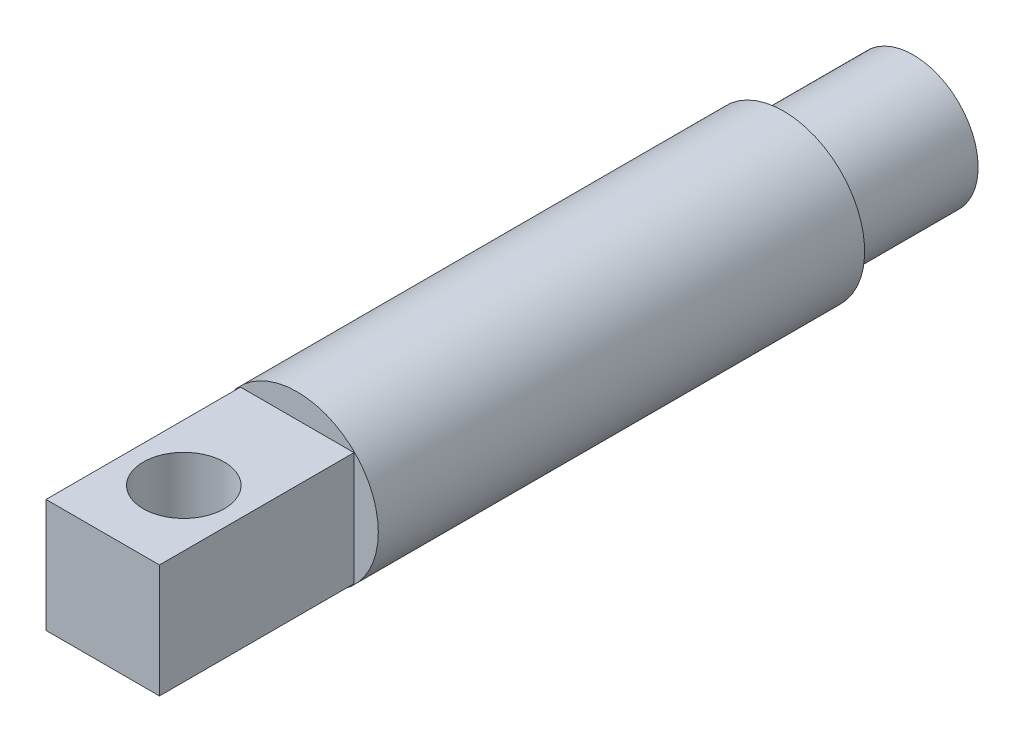
from build123d import *

# Parameters (mm, degrees)
ESQUISSE1_R                 = 5
BOSS_EXTRU_1_DEPTH          = 70
ESQUISSE2_R                 = 30
BOSS_EXTRU_2_DEPTH          = 5
ESQUISSE3_R                 = 3.5
BOSS_EXTRU_3_DEPTH          = 12
BOSS_EXTRU_4_START          = 12
ESQUISSE4_R                 = 3.5
BOSS_EXTRU_4_DEPTH          = 12
ENL_V_MAT_EXTRU_1_DEPTH     = 10
ESQUISSE6_R                 = 30
ENL_V_MAT_EXTRU_2_DEPTH     = 47
ESQUISSE7_R                 = 5
BOSS_EXTRU_5_DEPTH          = 3
ESQUISSE8_R                 = 4
BOSS_EXTRU_6_DEPTH          = 12
ENL_V_START                 = -12
ENL_V_MAT_EXTRU_3_OUTLINE_R = 5
ENL_V_MAT_EXTRU_3_OUTLINE_W = 7
ENL_V_MAT_EXTRU_3_OUTLINE_H = 7
ENL_V_MAT_EXTRU_3_DEPTH     = 12
ESQUISSE10_R                = 2.5
ENL_V_MAT_EXTRU_4_DEPTH     = 40.258756985
BOSS_EXTRU_7_START          = 4
ESQUISSE11_R                = 5
ESQUISSE11_R_2              = 4
BOSS_EXTRU_7_DEPTH          = 4


# Read off the part's stored shape, not the designer's step: Enlèv. mat.-Extru.3
with BuildPart() as part:
    # Esquisse1 → Boss.-Extru.1 (new body)
    with BuildSketch(Plane.XY):
        Circle(ESQUISSE1_R)
    extrude(amount=BOSS_EXTRU_1_DEPTH)

    # Esquisse2 → Boss.-Extru.2 (add)
    with BuildSketch(Plane.XY.offset(70)):
        Circle(ESQUISSE2_R)
    extrude(amount=-BOSS_EXTRU_2_DEPTH)

    # Esquisse3 → Boss.-Extru.3 (add)
    with BuildSketch(Plane(origin=(0, 0, 0), x_dir=(-1, 0, 0), z_dir=(0, 0, -1))):
        Circle(ESQUISSE3_R)
    extrude(amount=BOSS_EXTRU_3_DEPTH)

    # Esquisse4 → Boss.-Extru.4 (add)
    with BuildSketch(Plane.XY.offset(70).offset(BOSS_EXTRU_4_START)):
        with Locations(Location((0, 0, 0), (0, 0, 180))):
            Circle(ESQUISSE4_R)
    extrude(amount=-BOSS_EXTRU_4_DEPTH)

    # Esquisse5 → Enlèv. mat.-Extru.1 (cut)
    with BuildSketch(Plane.XY.offset(70)):
        with BuildLine():
            ThreePointArc((3.911624902, 29.743893333), (1.96, 29.935904864), (0, 30))
            Line((0, 30), (1.54, 24.952522919))
            ThreePointArc((1.54, 24.952522919), (1.639797772, 24.946163298), (1.739569306, 24.939404536))
            Line((1.739569306, 24.939404536), (3.911624902, 29.743893333))
        make_face()
        with BuildLine():
            Line((-1.54, 24.952522919), (0, 30))
            ThreePointArc((0, 30), (-1.96, 29.935904864), (-3.911624902, 29.743893333))
            Line((-3.911624902, 29.743893333), (-1.739569306, 24.939404536))
            ThreePointArc((-1.739569306, 24.939404536), (-1.639797772, 24.946163298), (-1.54, 24.952522919))
        make_face()
        with BuildLine():
            ThreePointArc((7.75646359, 28.979946042), (5.846535396, 29.424785876), (3.911624902, 29.743893333))
            Line((3.911624902, 29.743893333), (4.793067146, 24.536228466))
            ThreePointArc((4.793067146, 24.536228466), (4.878466786, 24.519391547), (4.963807286, 24.50225739))
            Line((4.963807286, 24.50225739), (7.75646359, 28.979946042))
        make_face()
        with BuildLine():
            Line((-4.793067146, 24.536228466), (-3.911624902, 29.743893333))
            ThreePointArc((-3.911624902, 29.743893333), (-5.846535396, 29.424785876), (-7.75646359, 28.979946042))
            Line((-7.75646359, 28.979946042), (-4.963807286, 24.50225739))
            ThreePointArc((-4.963807286, 24.50225739), (-4.878466786, 24.519391547), (-4.793067146, 24.536228466))
        make_face()
        with BuildLine():
            ThreePointArc((11.468870142, 27.721201591), (9.633248345, 28.411274634), (7.75646359, 28.979946042))
            Line((7.75646359, 28.979946042), (7.939081747, 23.705927128))
            ThreePointArc((7.939081747, 23.705927128), (8.021571427, 23.678141647), (8.103963866, 23.650069126))
            Line((8.103963866, 23.650069126), (11.468870142, 27.721201591))
        make_face()
        with BuildLine():
            Line((-7.939081747, 23.705927128), (-7.75646359, 28.979946042))
            ThreePointArc((-7.75646359, 28.979946042), (-9.633248345, 28.411274634), (-11.468870142, 27.721201591))
            Line((-11.468870142, 27.721201591), (-8.103963866, 23.650069126))
            ThreePointArc((-8.103963866, 23.650069126), (-8.021571427, 23.678141647), (-7.939081747, 23.705927128))
        make_face()
        with BuildLine():
            ThreePointArc((14.985459754, 25.989151505), (13.255485353, 26.912675602), (11.468870142, 27.721201591))
            Line((11.468870142, 27.721201591), (10.950617091, 22.474073626))
            ThreePointArc((10.950617091, 22.474073626), (11.04042578, 22.430091364), (11.130057821, 22.38575022))
            Line((11.130057821, 22.38575022), (14.985459754, 25.989151505))
        make_face()
        with BuildLine():
            Line((-10.950617091, 22.474073626), (-11.468870142, 27.721201591))
            ThreePointArc((-11.468870142, 27.721201591), (-13.255485353, 26.912675602), (-14.985459754, 25.989151505))
            Line((-14.985459754, 25.989151505), (-11.130057821, 22.38575022))
            ThreePointArc((-11.130057821, 22.38575022), (-11.04042578, 22.430091364), (-10.950617091, 22.474073626))
        make_face()
        with BuildLine():
            ThreePointArc((18.246190956, 23.813368422), (16.65140115, 24.954575527), (14.985459754, 25.989151505))
            Line((14.985459754, 25.989151505), (13.798277376, 20.847243018))
            ThreePointArc((13.798277376, 20.847243018), (13.870778356, 20.799074686), (13.943111187, 20.750654217))
            Line((13.943111187, 20.750654217), (18.246190956, 23.813368422))
        make_face()
        with BuildLine():
            Line((-13.798277376, 20.847243018), (-14.985459754, 25.989151505))
            ThreePointArc((-14.985459754, 25.989151505), (-16.65140115, 24.954575527), (-18.246190956, 23.813368422))
            Line((-18.246190956, 23.813368422), (-13.943111187, 20.750654217))
            ThreePointArc((-13.943111187, 20.750654217), (-13.870778356, 20.799074686), (-13.798277376, 20.847243018))
        make_face()
        with BuildLine():
            ThreePointArc((21.195390749, 21.231001177), (19.763014623, 22.570406576), (18.246190956, 23.813368422))
            Line((18.246190956, 23.813368422), (16.388920873, 18.878645942))
            ThreePointArc((16.388920873, 18.878645942), (16.464304345, 18.812939229), (16.539424387, 18.746931507))
            Line((16.539424387, 18.746931507), (21.195390749, 21.231001177))
        make_face()
        with BuildLine():
            Line((-16.388920873, 18.878645942), (-18.246190956, 23.813368422))
            ThreePointArc((-18.246190956, 23.813368422), (-19.763014623, 22.570406576), (-21.195390749, 21.231001177))
            Line((-21.195390749, 21.231001177), (-16.539424387, 18.746931507))
            ThreePointArc((-16.539424387, 18.746931507), (-16.464304345, 18.812939229), (-16.388920873, 18.878645942))
        make_face()
        with BuildLine():
            ThreePointArc((23.78270515, 18.286140537), (22.537198777, 19.800875518), (21.195390749, 21.231001177))
            Line((21.195390749, 21.231001177), (18.719140508, 16.57087139))
            ThreePointArc((18.719140508, 16.57087139), (18.78527424, 16.495862261), (18.851107406, 16.420589196))
            Line((18.851107406, 16.420589196), (23.78270515, 18.286140537))
        make_face()
        with BuildLine():
            Line((-18.719140508, 16.57087139), (-21.195390749, 21.231001177))
            ThreePointArc((-21.195390749, 21.231001177), (-22.537198777, 19.800875518), (-23.78270515, 18.286140537))
            Line((-23.78270515, 18.286140537), (-18.851107406, 16.420589196))
            ThreePointArc((-18.851107406, 16.420589196), (-18.78527424, 16.495862261), (-18.719140508, 16.57087139))
        make_face()
        with BuildLine():
            ThreePointArc((25.963958928, 15.029066397), (24.926587807, 16.693268712), (23.78270515, 18.286140537))
            Line((23.78270515, 18.286140537), (20.727218802, 13.97792548))
            ThreePointArc((20.727218802, 13.97792548), (20.775760628, 13.905674034), (20.824050599, 13.833254016))
            Line((20.824050599, 13.833254016), (25.963958928, 15.029066397))
        make_face()
        with BuildLine():
            Line((-20.727218802, 13.97792548), (-23.78270515, 18.286140537))
            ThreePointArc((-23.78270515, 18.286140537), (-24.926587807, 16.693268712), (-25.963958928, 15.029066397))
            Line((-25.963958928, 15.029066397), (-20.824050599, 13.833254016))
            ThreePointArc((-20.824050599, 13.833254016), (-20.775760628, 13.905674034), (-20.727218802, 13.97792548))
        make_face()
        with BuildLine():
            ThreePointArc((27.701909842, 11.515389317), (26.890385817, 13.300644745), (25.963958928, 15.029066397))
            Line((25.963958928, 15.029066397), (22.367034749, 11.167620899))
            ThreePointArc((22.367034749, 11.167620899), (22.405781894, 11.089677079), (22.444257425, 11.011598824))
            Line((22.444257425, 11.011598824), (27.701909842, 11.515389317))
        make_face()
        with BuildLine():
            Line((-22.367034749, 11.167620899), (-25.963958928, 15.029066397))
            ThreePointArc((-25.963958928, 15.029066397), (-26.890385817, 13.300644745), (-27.701909842, 11.515389317))
            Line((-27.701909842, 11.515389317), (-22.444257425, 11.011598824))
            ThreePointArc((-22.444257425, 11.011598824), (-22.405781894, 11.089677079), (-22.367034749, 11.167620899))
        make_face()
        with BuildLine():
            ThreePointArc((28.966884502, 7.805101039), (28.395063354, 9.680928526), (27.701909842, 11.515389317))
            Line((27.701909842, 11.515389317), (23.627977885, 8.168149181))
            ThreePointArc((23.627977885, 8.168149181), (23.660461458, 8.073571924), (23.692566461, 7.97886549))
            Line((23.692566461, 7.97886549), (28.966884502, 7.805101039))
        make_face()
        with BuildLine():
            Line((-23.627977885, 8.168149181), (-27.701909842, 11.515389317))
            ThreePointArc((-27.701909842, 11.515389317), (-28.395063354, 9.680928526), (-28.966884502, 7.805101039))
            Line((-28.966884502, 7.805101039), (-23.692566461, 7.97886549))
            ThreePointArc((-23.692566461, 7.97886549), (-23.660461458, 8.073571924), (-23.627977885, 8.168149181))
        make_face()
        with BuildLine():
            ThreePointArc((29.737285014, 3.9615502), (29.41492989, 5.895922284), (28.966884502, 7.805101039))
            Line((28.966884502, 7.805101039), (24.493890167, 5.004932014))
            ThreePointArc((24.493890167, 5.004932014), (24.513713944, 4.906916414), (24.533145499, 4.808822302))
            Line((24.533145499, 4.808822302), (29.737285014, 3.9615502))
        make_face()
        with BuildLine():
            Line((-24.493890167, 5.004932014), (-28.966884502, 7.805101039))
            ThreePointArc((-28.966884502, 7.805101039), (-29.41492989, 5.895922284), (-29.737285014, 3.9615502))
            Line((-29.737285014, 3.9615502), (-24.533145499, 4.808822302))
            ThreePointArc((-24.533145499, 4.808822302), (-24.513713944, 4.906916414), (-24.493890167, 5.004932014))
        make_face()
        with BuildLine():
            ThreePointArc((29.99995773, 0.050360733), (29.932572449, 2.010250376), (29.737285014, 3.9615502))
            Line((29.737285014, 3.9615502), (24.938282315, 1.755583995))
            ThreePointArc((24.938282315, 1.755583995), (24.944243639, 1.668744817), (24.949902576, 1.581885408))
            Line((24.949902576, 1.581885408), (29.99995773, 0.050360733))
        make_face()
        with BuildLine():
            Line((-24.938282315, 1.755583995), (-29.737285014, 3.9615502))
            ThreePointArc((-29.737285014, 3.9615502), (-29.932572449, 2.010250376), (-29.99995773, 0.050360733))
            Line((-29.99995773, 0.050360733), (-24.949902576, 1.581885408))
            ThreePointArc((-24.949902576, 1.581885408), (-24.944243639, 1.668744817), (-24.938282315, 1.755583995))
        make_face()
        with BuildLine():
            Line((-24.949902576, -1.581885408), (-29.99995773, -0.050360733))
            ThreePointArc((-29.99995773, -0.050360733), (-29.932572449, -2.010250376), (-29.737285014, -3.9615502))
            Line((-29.737285014, -3.9615502), (-24.938282315, -1.755583995))
            ThreePointArc((-24.938282315, -1.755583995), (-24.944243639, -1.668744817), (-24.949902576, -1.581885408))
        make_face()
        with BuildLine():
            ThreePointArc((29.737285014, -3.9615502), (29.932572449, -2.010250376), (29.99995773, -0.050360733))
            Line((29.99995773, -0.050360733), (24.949902576, -1.581885408))
            ThreePointArc((24.949902576, -1.581885408), (24.944243639, -1.668744817), (24.938282315, -1.755583995))
            Line((24.938282315, -1.755583995), (29.737285014, -3.9615502))
        make_face()
        with BuildLine():
            Line((-24.533145499, -4.808822302), (-29.737285014, -3.9615502))
            ThreePointArc((-29.737285014, -3.9615502), (-29.41492989, -5.895922284), (-28.966884502, -7.805101039))
            Line((-28.966884502, -7.805101039), (-24.493890167, -5.004932014))
            ThreePointArc((-24.493890167, -5.004932014), (-24.513713944, -4.906916414), (-24.533145499, -4.808822302))
        make_face()
        with BuildLine():
            ThreePointArc((28.966884502, -7.805101039), (29.41492989, -5.895922284), (29.737285014, -3.9615502))
            Line((29.737285014, -3.9615502), (24.533145499, -4.808822302))
            ThreePointArc((24.533145499, -4.808822302), (24.513713944, -4.906916414), (24.493890167, -5.004932014))
            Line((24.493890167, -5.004932014), (28.966884502, -7.805101039))
        make_face()
        with BuildLine():
            Line((-23.692566461, -7.97886549), (-28.966884502, -7.805101039))
            ThreePointArc((-28.966884502, -7.805101039), (-28.395063354, -9.680928526), (-27.701909842, -11.515389317))
            Line((-27.701909842, -11.515389317), (-23.627977885, -8.168149181))
            ThreePointArc((-23.627977885, -8.168149181), (-23.660461458, -8.073571924), (-23.692566461, -7.97886549))
        make_face()
        with BuildLine():
            ThreePointArc((27.701909842, -11.515389317), (28.395063354, -9.680928526), (28.966884502, -7.805101039))
            Line((28.966884502, -7.805101039), (23.692566461, -7.97886549))
            ThreePointArc((23.692566461, -7.97886549), (23.660461458, -8.073571924), (23.627977885, -8.168149181))
            Line((23.627977885, -8.168149181), (27.701909842, -11.515389317))
        make_face()
        with BuildLine():
            Line((-22.444257425, -11.011598824), (-27.701909842, -11.515389317))
            ThreePointArc((-27.701909842, -11.515389317), (-26.890385817, -13.300644745), (-25.963958928, -15.029066397))
            Line((-25.963958928, -15.029066397), (-22.367034749, -11.167620899))
            ThreePointArc((-22.367034749, -11.167620899), (-22.405781894, -11.089677079), (-22.444257425, -11.011598824))
        make_face()
        with BuildLine():
            ThreePointArc((25.963958928, -15.029066397), (26.890385817, -13.300644745), (27.701909842, -11.515389317))
            Line((27.701909842, -11.515389317), (22.444257425, -11.011598824))
            ThreePointArc((22.444257425, -11.011598824), (22.405781894, -11.089677079), (22.367034749, -11.167620899))
            Line((22.367034749, -11.167620899), (25.963958928, -15.029066397))
        make_face()
        with BuildLine():
            Line((-20.824050599, -13.833254016), (-25.963958928, -15.029066397))
            ThreePointArc((-25.963958928, -15.029066397), (-24.926587807, -16.693268712), (-23.78270515, -18.286140537))
            Line((-23.78270515, -18.286140537), (-20.727218802, -13.97792548))
            ThreePointArc((-20.727218802, -13.97792548), (-20.775760628, -13.905674034), (-20.824050599, -13.833254016))
        make_face()
        with BuildLine():
            ThreePointArc((23.78270515, -18.286140537), (24.926587807, -16.693268712), (25.963958928, -15.029066397))
            Line((25.963958928, -15.029066397), (20.824050599, -13.833254016))
            ThreePointArc((20.824050599, -13.833254016), (20.775760628, -13.905674034), (20.727218802, -13.97792548))
            Line((20.727218802, -13.97792548), (23.78270515, -18.286140537))
        make_face()
        with BuildLine():
            Line((-18.851107406, -16.420589196), (-23.78270515, -18.286140537))
            ThreePointArc((-23.78270515, -18.286140537), (-22.537198777, -19.800875518), (-21.195390749, -21.231001177))
            Line((-21.195390749, -21.231001177), (-18.719140508, -16.57087139))
            ThreePointArc((-18.719140508, -16.57087139), (-18.78527424, -16.495862261), (-18.851107406, -16.420589196))
        make_face()
        with BuildLine():
            ThreePointArc((21.195390749, -21.231001177), (22.537198777, -19.800875518), (23.78270515, -18.286140537))
            Line((23.78270515, -18.286140537), (18.851107406, -16.420589196))
            ThreePointArc((18.851107406, -16.420589196), (18.78527424, -16.495862261), (18.719140508, -16.57087139))
            Line((18.719140508, -16.57087139), (21.195390749, -21.231001177))
        make_face()
        with BuildLine():
            Line((-16.539424387, -18.746931507), (-21.195390749, -21.231001177))
            ThreePointArc((-21.195390749, -21.231001177), (-19.763014623, -22.570406576), (-18.246190956, -23.813368422))
            Line((-18.246190956, -23.813368422), (-16.388920873, -18.878645942))
            ThreePointArc((-16.388920873, -18.878645942), (-16.464304345, -18.812939229), (-16.539424387, -18.746931507))
        make_face()
        with BuildLine():
            ThreePointArc((18.246190956, -23.813368422), (19.763014623, -22.570406576), (21.195390749, -21.231001177))
            Line((21.195390749, -21.231001177), (16.539424387, -18.746931507))
            ThreePointArc((16.539424387, -18.746931507), (16.464304345, -18.812939229), (16.388920873, -18.878645942))
            Line((16.388920873, -18.878645942), (18.246190956, -23.813368422))
        make_face()
        with BuildLine():
            Line((-13.943111187, -20.750654217), (-18.246190956, -23.813368422))
            ThreePointArc((-18.246190956, -23.813368422), (-16.65140115, -24.954575527), (-14.985459754, -25.989151505))
            Line((-14.985459754, -25.989151505), (-13.798277376, -20.847243018))
            ThreePointArc((-13.798277376, -20.847243018), (-13.870778356, -20.799074686), (-13.943111187, -20.750654217))
        make_face()
        with BuildLine():
            ThreePointArc((14.985459754, -25.989151505), (16.65140115, -24.954575527), (18.246190956, -23.813368422))
            Line((18.246190956, -23.813368422), (13.943111187, -20.750654217))
            ThreePointArc((13.943111187, -20.750654217), (13.870778356, -20.799074686), (13.798277376, -20.847243018))
            Line((13.798277376, -20.847243018), (14.985459754, -25.989151505))
        make_face()
        with BuildLine():
            Line((-11.130057821, -22.38575022), (-14.985459754, -25.989151505))
            ThreePointArc((-14.985459754, -25.989151505), (-13.255485353, -26.912675602), (-11.468870142, -27.721201591))
            Line((-11.468870142, -27.721201591), (-10.950617091, -22.474073626))
            ThreePointArc((-10.950617091, -22.474073626), (-11.04042578, -22.430091364), (-11.130057821, -22.38575022))
        make_face()
        with BuildLine():
            ThreePointArc((11.468870142, -27.721201591), (13.255485353, -26.912675602), (14.985459754, -25.989151505))
            Line((14.985459754, -25.989151505), (11.130057821, -22.38575022))
            ThreePointArc((11.130057821, -22.38575022), (11.04042578, -22.430091364), (10.950617091, -22.474073626))
            Line((10.950617091, -22.474073626), (11.468870142, -27.721201591))
        make_face()
        with BuildLine():
            Line((-8.103963866, -23.650069126), (-11.468870142, -27.721201591))
            ThreePointArc((-11.468870142, -27.721201591), (-9.633248345, -28.411274634), (-7.75646359, -28.979946042))
            Line((-7.75646359, -28.979946042), (-7.939081747, -23.705927128))
            ThreePointArc((-7.939081747, -23.705927128), (-8.021571427, -23.678141647), (-8.103963866, -23.650069126))
        make_face()
        with BuildLine():
            ThreePointArc((7.75646359, -28.979946042), (9.633248345, -28.411274634), (11.468870142, -27.721201591))
            Line((11.468870142, -27.721201591), (8.103963866, -23.650069126))
            ThreePointArc((8.103963866, -23.650069126), (8.021571427, -23.678141647), (7.939081747, -23.705927128))
            Line((7.939081747, -23.705927128), (7.75646359, -28.979946042))
        make_face()
        with BuildLine():
            Line((-4.963807286, -24.50225739), (-7.75646359, -28.979946042))
            ThreePointArc((-7.75646359, -28.979946042), (-5.846535396, -29.424785876), (-3.911624902, -29.743893333))
            Line((-3.911624902, -29.743893333), (-4.793067146, -24.536228466))
            ThreePointArc((-4.793067146, -24.536228466), (-4.878466786, -24.519391547), (-4.963807286, -24.50225739))
        make_face()
        with BuildLine():
            ThreePointArc((3.911624902, -29.743893333), (5.846535396, -29.424785876), (7.75646359, -28.979946042))
            Line((7.75646359, -28.979946042), (4.963807286, -24.50225739))
            ThreePointArc((4.963807286, -24.50225739), (4.878466786, -24.519391547), (4.793067146, -24.536228466))
            Line((4.793067146, -24.536228466), (3.911624902, -29.743893333))
        make_face()
        with BuildLine():
            Line((-1.739569306, -24.939404536), (-3.911624902, -29.743893333))
            ThreePointArc((-3.911624902, -29.743893333), (-1.96, -29.935904864), (0, -30))
            Line((0, -30), (-1.54, -24.952522919))
            ThreePointArc((-1.54, -24.952522919), (-1.639797772, -24.946163298), (-1.739569306, -24.939404536))
        make_face()
        with BuildLine():
            ThreePointArc((0, -30), (1.96, -29.935904864), (3.911624902, -29.743893333))
            Line((3.911624902, -29.743893333), (1.739569306, -24.939404536))
            ThreePointArc((1.739569306, -24.939404536), (1.639797772, -24.946163298), (1.54, -24.952522919))
            Line((1.54, -24.952522919), (0, -30))
        make_face()
    extrude(amount=-ENL_V_MAT_EXTRU_1_DEPTH, mode=Mode.SUBTRACT)

    # Esquisse6 → Enlèv. mat.-Extru.2 (cut)
    with BuildSketch(Plane.XY.offset(82)):
        Circle(ESQUISSE6_R)
    extrude(amount=-ENL_V_MAT_EXTRU_2_DEPTH, mode=Mode.SUBTRACT)

    # Esquisse7 → Boss.-Extru.5 (add)
    with BuildSketch(Plane.XY.offset(35)):
        Circle(ESQUISSE7_R)
    extrude(amount=BOSS_EXTRU_5_DEPTH)

    # Esquisse8 → Boss.-Extru.6 (add)
    with BuildSketch(Plane(origin=(0, 0, -12), x_dir=(-1, 0, 0), z_dir=(0, 0, -1))):
        Circle(ESQUISSE8_R)
    extrude(amount=-BOSS_EXTRU_6_DEPTH)

    # Enlèv. mat.-Extru.3 outline → Enlèv. mat.-Extru.3 (cut)
    with BuildSketch(Plane.XY.offset(38).offset(ENL_V_START)):
        Circle(ENL_V_MAT_EXTRU_3_OUTLINE_R)
        Rectangle(ENL_V_MAT_EXTRU_3_OUTLINE_W, ENL_V_MAT_EXTRU_3_OUTLINE_H, mode=Mode.SUBTRACT)
    extrude(amount=ENL_V_MAT_EXTRU_3_DEPTH, mode=Mode.SUBTRACT)

    # Esquisse10 → Enlèv. mat.-Extru.4 (cut, through all)
    with BuildSketch(Plane(origin=(0, 3.5, 0), x_dir=(1, 0, 0), z_dir=(0, 1, 0))):
        with Locations(Location((0, -33, 0), (0, 0, 270))):
            Circle(ESQUISSE10_R)
    extrude(amount=-ENL_V_MAT_EXTRU_4_DEPTH, mode=Mode.SUBTRACT)

    # Esquisse11 → Boss.-Extru.7 (add)
    with BuildSketch(Plane(origin=(0, 0, 0), x_dir=(-1, 0, 0), z_dir=(0, 0, -1)).offset(BOSS_EXTRU_7_START)):
        Circle(ESQUISSE11_R)
        Circle(ESQUISSE11_R_2, mode=Mode.SUBTRACT)
    extrude(amount=-BOSS_EXTRU_7_DEPTH)


solid = part.part
